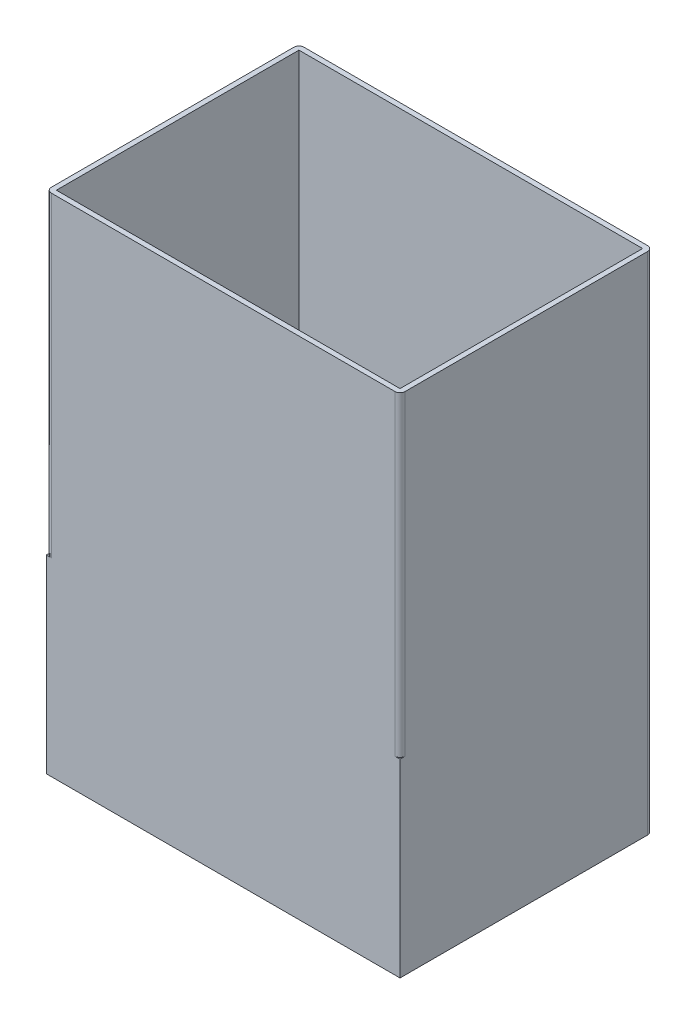
from build123d import *

# Parameters (mm, degrees)
SKETCH1_W           = 177.8
SKETCH1_H           = 127
BOSS_EXTRUDE1_DEPTH = 254
SKETCH2_W           = 172.72
SKETCH2_H           = 121.92
CUT_EXTRUDE1_DEPTH  = 248.92
FILLET2_R           = 2.54
FILLET3_START       = 95.25
FILLET3_DEPTH       = 159.75


with BuildPart() as part:
    # Sketch1 → Boss-Extrude1 (new body)
    with BuildSketch(Plane(origin=(0, 0, 0), x_dir=(1, 0, 0), z_dir=(0, 1, 0))):
        with Locations((88.9, 63.5)):
            Rectangle(SKETCH1_W, SKETCH1_H)
    extrude(amount=BOSS_EXTRUDE1_DEPTH)

    # Sketch2 → Cut-Extrude1 (cut)
    with BuildSketch(Plane(origin=(0, 254, 0), x_dir=(1, 0, 0), z_dir=(0, 1, 0))):
        with Locations((88.9, 63.5)):
            Rectangle(SKETCH2_W, SKETCH2_H)
    extrude(amount=-CUT_EXTRUDE1_DEPTH, mode=Mode.SUBTRACT)

    # Fillet2
    fillet2_edges = [part.edges().sort_by_distance(p)[0] for p in [
        (0, 127, -127),
        (177.8, 127, -127),
    ]]
    fillet(fillet2_edges, radius=FILLET2_R)

    # Fillet3: read off the stored shape, not the designer's step
    # Fillet3 outline → Fillet3 (cut)
    with BuildSketch(Plane(origin=(0, 0, 0), x_dir=(1, 0, 0), z_dir=(0, 1, 0)).offset(FILLET3_START)):
        with BuildLine():
            Line((0, 0), (2.54, 0))
            ThreePointArc((2.54, 0), (0.743948776, 0.743948776), (0, 2.54))
            Line((0, 2.54), (0, 0))
        make_face()
        with BuildLine():
            ThreePointArc((177.8, 2.54), (177.056051224, 0.743948776), (175.26, 0))
            Line((175.26, 0), (177.8, 0))
            Line((177.8, 0), (177.8, 2.54))
        make_face()
    extrude(amount=FILLET3_DEPTH, mode=Mode.SUBTRACT)


solid = part.part
